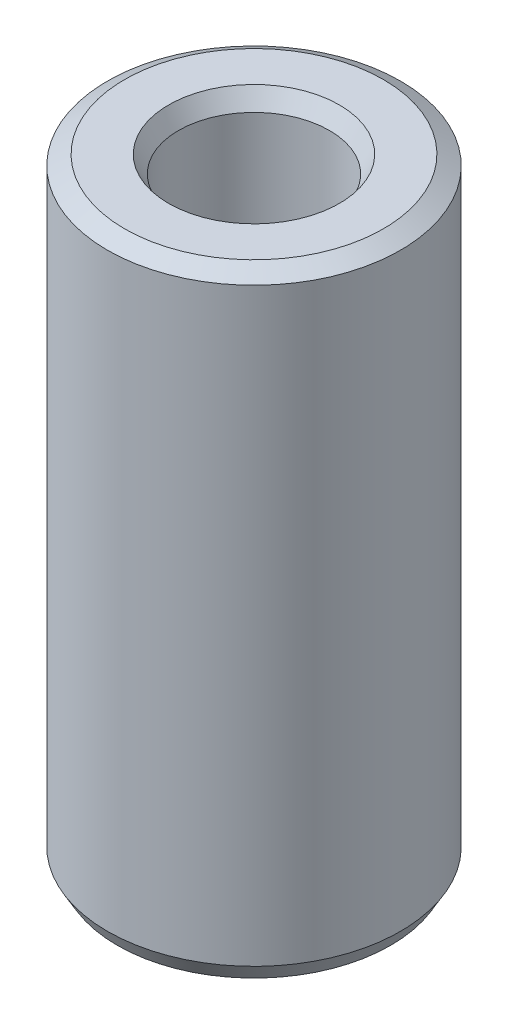
from build123d import *
from OCP.BRepFilletAPI import BRepFilletAPI_MakeChamfer

# Parameters (mm, degrees)
SKETCH1_R           = 52.5
BOSS_EXTRUDE1_DEPTH = 221.029050381
SKETCH2_R           = 27.0374596
CUT_EXTRUDE1_DEPTH  = 234.165908984
CHAMFER1_SIZE       = 3.551390202
CHAMFER1_SIZE2      = 6.151188267


with BuildPart() as part:
    # Sketch1 → Boss-Extrude1 (new body)
    with BuildSketch(Plane(origin=(0, 0, 0), x_dir=(1, 0, 0), z_dir=(0, 1, 0))):
        Circle(SKETCH1_R)
    extrude(amount=BOSS_EXTRUDE1_DEPTH)

    # Sketch2 → Cut-Extrude1 (cut, through all)
    with BuildSketch(Plane(origin=(0, 0, 0), x_dir=(1, 0, 0), z_dir=(0, 1, 0))):
        Circle(SKETCH2_R)
    extrude(amount=CUT_EXTRUDE1_DEPTH, mode=Mode.SUBTRACT)

    # Chamfer1: one chamfer whose edges measure the first distance from different faces: ONE call of the kernel's chamfer builder (chamfer() names one face for all edges)
    chamfer1_edges_1 = [part.edges().sort_by_distance(p)[0] for p in [
        (-27.0374596, 221.029050381, 0),
    ]]
    chamfer1_side_1 = [part.faces().sort_by_distance(p)[0] for p in [
        (-51.01507576, 221.029050381, 0),
    ]]
    chamfer1_edges_2 = [part.edges().sort_by_distance(p)[0] for p in [
        (-27.0374596, 0, 0),
    ]]
    chamfer1_side_2 = [part.faces().sort_by_distance(p)[0] for p in [
        (-27.0374596, 110.514525191, 0),
    ]]
    chamfer1_edges_3 = [part.edges().sort_by_distance(p)[0] for p in [
        (-52.5, 0, 0),
    ]]
    chamfer1_side_3 = [part.faces().sort_by_distance(p)[0] for p in [
        (-51.01507576, 0, 0),
    ]]
    chamfer1_edges_4 = [part.edges().sort_by_distance(p)[0] for p in [
        (-52.5, 221.029050381, 0),
    ]]
    chamfer1_side_4 = [part.faces().sort_by_distance(p)[0] for p in [
        (-52.5, 110.514525191, 0),
    ]]
    chamfer1 = BRepFilletAPI_MakeChamfer(part.part.solid().wrapped)
    for e in chamfer1_edges_1:
        chamfer1.Add(CHAMFER1_SIZE, CHAMFER1_SIZE2, e.wrapped, chamfer1_side_1[0].wrapped)  # the first distance lies on this face
    for e in chamfer1_edges_2:
        chamfer1.Add(CHAMFER1_SIZE, CHAMFER1_SIZE2, e.wrapped, chamfer1_side_2[0].wrapped)  # the first distance lies on this face
    for e in chamfer1_edges_3:
        chamfer1.Add(CHAMFER1_SIZE, CHAMFER1_SIZE2, e.wrapped, chamfer1_side_3[0].wrapped)  # the first distance lies on this face
    for e in chamfer1_edges_4:
        chamfer1.Add(CHAMFER1_SIZE, CHAMFER1_SIZE2, e.wrapped, chamfer1_side_4[0].wrapped)  # the first distance lies on this face
    add(Compound.cast(chamfer1.Shape()), mode=Mode.REPLACE)


solid = part.part
